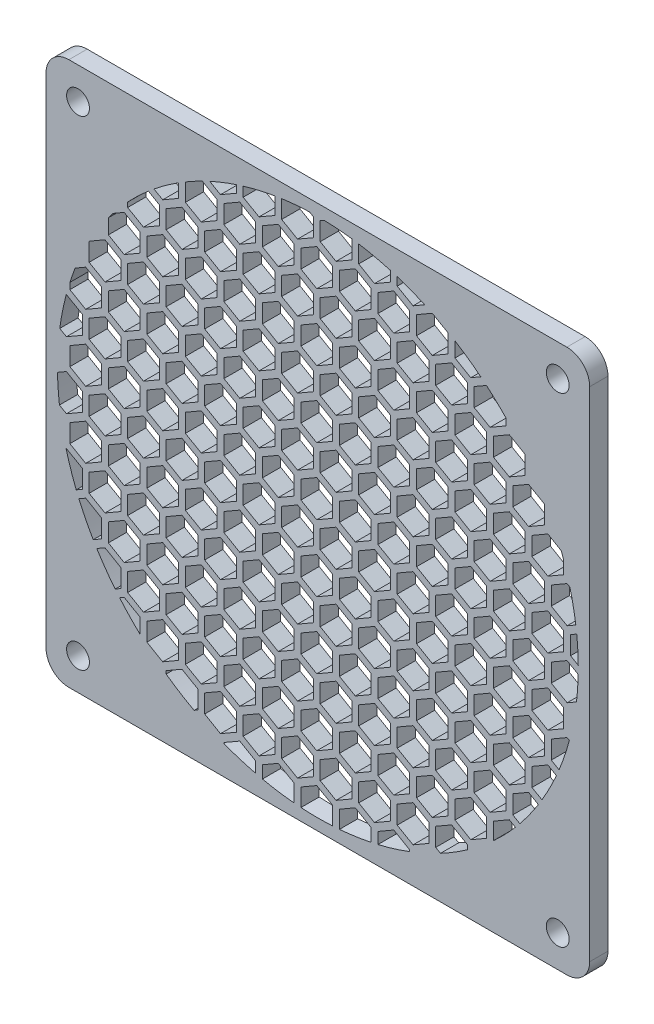
from build123d import *

# Parameters (mm, degrees)
ESQUISSE1_W        = 119
ESQUISSE1_H        = 119
ESQUISSE1_R        = 2.5
BOSS_EXTRU_2_DEPTH = 4
CONG_1_R           = 5


with BuildPart() as part:
    # Esquisse1 → Boss.-Extru.2 (new body)
    with BuildSketch(Plane.XY):
        Rectangle(ESQUISSE1_W, ESQUISSE1_H)
        with Locations((-52.5, -52.5)):
            Circle(ESQUISSE1_R, mode=Mode.SUBTRACT)
        with Locations((52.5, -52.5)):
            Circle(ESQUISSE1_R, mode=Mode.SUBTRACT)
        with Locations((-52.5, 52.5)):
            Circle(ESQUISSE1_R, mode=Mode.SUBTRACT)
        with BuildLine():
            ThreePointArc((-35.866884284, 44.300864684), (-33.23819598, 46.305748326), (-30.497695155, 48.154860505))
            Line((-30.497695155, 48.154860505), (-30.497695155, 45.200961894))
            Line((-30.497695155, 45.200961894), (-33.96179677, 43.200961894))
            Line((-33.96179677, 43.200961894), (-35.866884284, 44.300864684))
        make_face(mode=Mode.SUBTRACT)
        with BuildLine():
            ThreePointArc((-41.64, 38.924419071), (-39.427222396, 41.164233677), (-37.094146812, 43.278450438))
            Line((-37.094146812, 43.278450438), (-34.71179677, 41.903))
            Line((-34.71179677, 41.903), (-34.71179677, 37.903))
            Line((-34.71179677, 37.903), (-38.175898385, 35.903))
            Line((-38.175898385, 35.903), (-41.64, 37.903))
            Line((-41.64, 37.903), (-41.64, 38.924419071))
        make_face(mode=Mode.SUBTRACT)
        with BuildLine():
            ThreePointArc((-45.855898385, 33.856115892), (-45.35289473, 34.527017532), (-44.840076176, 35.19044712))
            Line((-44.840076176, 35.19044712), (-42.39179677, 36.603961894))
            Line((-42.39179677, 36.603961894), (-38.927695155, 34.603961894))
            Line((-38.927695155, 34.603961894), (-38.927695155, 30.603961894))
            Line((-38.927695155, 30.603961894), (-42.39179677, 28.603961894))
            Line((-42.39179677, 28.603961894), (-45.855898385, 30.603961894))
            Line((-45.855898385, 30.603961894), (-45.855898385, 33.856115892))
        make_face(mode=Mode.SUBTRACT)
        with BuildLine():
            ThreePointArc((-50.07, 27.239587001), (-50.043596751, 27.288063769), (-50.017146567, 27.336514944))
            Line((-50.017146567, 27.336514944), (-46.605898385, 29.306))
            Line((-46.605898385, 29.306), (-43.14179677, 27.306))
            Line((-43.14179677, 27.306), (-43.14179677, 23.306))
            Line((-43.14179677, 23.306), (-46.605898385, 21.306))
            Line((-46.605898385, 21.306), (-50.07, 23.306))
            Line((-50.07, 23.306), (-50.07, 27.239587001))
        make_face(mode=Mode.SUBTRACT)
        with BuildLine():
            ThreePointArc((-54.285898385, 17.379333605), (-53.725914344, 19.040118904), (-53.115134759, 20.682902589))
            Line((-53.115134759, 20.682902589), (-50.82179677, 22.006961894))
            Line((-50.82179677, 22.006961894), (-47.357695155, 20.006961894))
            Line((-47.357695155, 20.006961894), (-47.357695155, 16.006961894))
            Line((-47.357695155, 16.006961894), (-50.82179677, 14.006961894))
            Line((-50.82179677, 14.006961894), (-54.285898385, 16.006961894))
            Line((-54.285898385, 16.006961894), (-54.285898385, 17.379333605))
        make_face(mode=Mode.SUBTRACT)
        with BuildLine():
            ThreePointArc((-56.497392033, 7.552793751), (-55.900380768, 11.14214656), (-55.075571993, 14.686094432))
            Line((-55.075571993, 14.686094432), (-55.035898385, 14.709))
            Line((-55.035898385, 14.709), (-51.57179677, 12.709))
            Line((-51.57179677, 12.709), (-51.57179677, 8.709))
            Line((-51.57179677, 8.709), (-55.035898385, 6.709))
            Line((-55.035898385, 6.709), (-56.497392033, 7.552793751))
        make_face(mode=Mode.SUBTRACT)
        with BuildLine():
            ThreePointArc((-56.568125599, -7.003368205), (-56.858374757, -4.015621994), (-56.990931229, -1.016738739))
            Line((-56.990931229, -1.016738739), (-55.035898385, 0.112))
            Line((-55.035898385, 0.112), (-51.57179677, -1.888))
            Line((-51.57179677, -1.888), (-51.57179677, -5.888))
            Line((-51.57179677, -5.888), (-55.035898385, -7.888))
            Line((-55.035898385, -7.888), (-56.568125599, -7.003368205))
        make_face(mode=Mode.SUBTRACT)
        with BuildLine():
            ThreePointArc((-52.891938546, -21.24718421), (-54.108530805, -17.923919609), (-55.116546513, -14.531562218))
            Line((-55.116546513, -14.531562218), (-55.035898385, -14.485))
            Line((-55.035898385, -14.485), (-51.57179677, -16.485))
            Line((-51.57179677, -16.485), (-51.57179677, -20.485))
            Line((-51.57179677, -20.485), (-52.891938546, -21.24718421))
        make_face(mode=Mode.SUBTRACT)
        with BuildLine():
            ThreePointArc((-49.170916986, -28.830902218), (-50.834496577, -25.784762123), (-52.30959477, -22.643018682))
            Line((-52.30959477, -22.643018682), (-50.82179677, -21.784038106))
            Line((-50.82179677, -21.784038106), (-47.357695155, -23.784038106))
            Line((-47.357695155, -23.784038106), (-47.357695155, -27.784038106))
            Line((-47.357695155, -27.784038106), (-49.170916986, -28.830902218))
        make_face(mode=Mode.SUBTRACT)
        with BuildLine():
            ThreePointArc((-44.364618001, -35.787996167), (-46.466520194, -33.013065611), (-48.395109956, -30.115001782))
            Line((-48.395109956, -30.115001782), (-46.605898385, -29.082))
            Line((-46.605898385, -29.082), (-43.14179677, -31.082))
            Line((-43.14179677, -31.082), (-43.14179677, -35.082))
            Line((-43.14179677, -35.082), (-44.364618001, -35.787996167))
        make_face(mode=Mode.SUBTRACT)
        with BuildLine():
            ThreePointArc((-38.927695155, -41.636937327), (-41.22702348, -39.361561643), (-43.393569507, -36.959411865))
            Line((-43.393569507, -36.959411865), (-42.39179677, -36.381038106))
            Line((-42.39179677, -36.381038106), (-38.927695155, -38.381038106))
            Line((-38.927695155, -38.381038106), (-38.927695155, -41.636937327))
        make_face(mode=Mode.SUBTRACT)
        with BuildLine():
            ThreePointArc((-27.094898404, -50.148444447), (-30.212960998, -48.334014811), (-33.21, -46.325974356))
            Line((-33.21, -46.325974356), (-33.21, -45.679))
            Line((-33.21, -45.679), (-29.745898385, -43.679))
            Line((-29.745898385, -43.679), (-26.28179677, -45.679))
            Line((-26.28179677, -45.679), (-26.28179677, -49.679))
            Line((-26.28179677, -49.679), (-27.094898404, -50.148444447))
        make_face(mode=Mode.SUBTRACT)
        with BuildLine():
            ThreePointArc((-13.637695155, -55.344496302), (-17.136623375, -54.363003406), (-20.565898385, -53.160547623))
            Line((-20.565898385, -53.160547623), (-20.565898385, -52.978038106))
            Line((-20.565898385, -52.978038106), (-17.10179677, -50.978038106))
            Line((-17.10179677, -50.978038106), (-13.637695155, -52.978038106))
            Line((-13.637695155, -52.978038106), (-13.637695155, -55.344496302))
        make_face(mode=Mode.SUBTRACT)
        with BuildLine():
            ThreePointArc((-5.207695155, -56.76160596), (-8.688238732, -56.333955193), (-12.135898385, -55.693087277))
            Line((-12.135898385, -55.693087277), (-12.135898385, -52.978038106))
            Line((-12.135898385, -52.978038106), (-8.67179677, -50.978038106))
            Line((-8.67179677, -50.978038106), (-5.207695155, -52.978038106))
            Line((-5.207695155, -52.978038106), (-5.207695155, -56.76160596))
        make_face(mode=Mode.SUBTRACT)
        with BuildLine():
            ThreePointArc((3.222304845, -56.908845986), (-0.24224455, -56.99948524), (-3.705898385, -56.879401519))
            Line((-3.705898385, -56.879401519), (-3.705898385, -52.978038106))
            Line((-3.705898385, -52.978038106), (-0.24179677, -50.978038106))
            Line((-0.24179677, -50.978038106), (3.222304845, -52.978038106))
            Line((3.222304845, -52.978038106), (3.222304845, -56.908845986))
        make_face(mode=Mode.SUBTRACT)
        with BuildLine():
            ThreePointArc((11.652304845, -55.796270411), (8.203688234, -56.406555464), (4.724101615, -56.803898316))
            Line((4.724101615, -56.803898316), (4.724101615, -52.978038106))
            Line((4.724101615, -52.978038106), (8.18820323, -50.978038106))
            Line((8.18820323, -50.978038106), (11.652304845, -52.978038106))
            Line((11.652304845, -52.978038106), (11.652304845, -55.796270411))
        make_face(mode=Mode.SUBTRACT)
        with BuildLine():
            ThreePointArc((20.082304845, -53.345112542), (16.651857936, -54.513444464), (13.154101615, -55.461424528))
            Line((13.154101615, -55.461424528), (13.154101615, -52.978038106))
            Line((13.154101615, -52.978038106), (16.61820323, -50.978038106))
            Line((16.61820323, -50.978038106), (20.082304845, -52.978038106))
            Line((20.082304845, -52.978038106), (20.082304845, -53.345112542))
        make_face(mode=Mode.SUBTRACT)
        with BuildLine():
            ThreePointArc((32.72820323, -46.66759811), (29.841537458, -48.564211537), (26.845296739, -50.282502354))
            Line((26.845296739, -50.282502354), (25.8, -49.679))
            Line((25.8, -49.679), (25.8, -45.679))
            Line((25.8, -45.679), (29.264101615, -43.679))
            Line((29.264101615, -43.679), (32.72820323, -45.679))
            Line((32.72820323, -45.679), (32.72820323, -46.66759811))
        make_face(mode=Mode.SUBTRACT)
        with BuildLine():
            ThreePointArc((43.233688705, -37.146307501), (40.913447759, -39.687400928), (38.444101615, -42.083857368))
            Line((38.444101615, -42.083857368), (38.444101615, -38.381038106))
            Line((38.444101615, -38.381038106), (41.90820323, -36.381038106))
            Line((41.90820323, -36.381038106), (43.233688705, -37.146307501))
        make_face(mode=Mode.SUBTRACT)
        with BuildLine():
            ThreePointArc((48.267324172, -30.31939012), (46.325661729, -33.210436092), (44.211070112, -35.977510747))
            Line((44.211070112, -35.977510747), (42.66, -35.082))
            Line((42.66, -35.082), (42.66, -31.082))
            Line((42.66, -31.082), (46.124101615, -29.082))
            Line((46.124101615, -29.082), (48.267324172, -30.31939012))
        make_face(mode=Mode.SUBTRACT)
        with BuildLine():
            ThreePointArc((52.21244951, -22.8661347), (50.724303411, -26.000866205), (49.048167948, -29.039235888))
            Line((49.048167948, -29.039235888), (46.874101615, -27.784038106))
            Line((46.874101615, -27.784038106), (46.874101615, -23.784038106))
            Line((46.874101615, -23.784038106), (50.33820323, -21.784038106))
            Line((50.33820323, -21.784038106), (52.21244951, -22.8661347))
        make_face(mode=Mode.SUBTRACT)
        with BuildLine():
            ThreePointArc((55.052406326, -14.772696359), (54.030546997, -18.157642776), (52.800779674, -21.472719105))
            Line((52.800779674, -21.472719105), (51.09, -20.485))
            Line((51.09, -20.485), (51.09, -16.485))
            Line((51.09, -16.485), (54.554101615, -14.485))
            Line((54.554101615, -14.485), (55.052406326, -14.772696359))
        make_face(mode=Mode.SUBTRACT)
        with BuildLine():
            ThreePointArc((56.9853625, -1.291689126), (56.859298223, -4.002524896), (56.604350723, -6.704288126))
            Line((56.604350723, -6.704288126), (54.554101615, -7.888))
            Line((54.554101615, -7.888), (51.09, -5.888))
            Line((51.09, -5.888), (51.09, -1.888))
            Line((51.09, -1.888), (54.554101615, 0.112))
            Line((54.554101615, 0.112), (56.9853625, -1.291689126))
        make_face(mode=Mode.SUBTRACT)
        with BuildLine():
            ThreePointArc((56.662438281, 6.194197934), (56.903390908, 3.317243317), (56.998364601, 0.431778704))
            Line((56.998364601, 0.431778704), (55.304101615, 1.409961894))
            Line((55.304101615, 1.409961894), (55.304101615, 5.409961894))
            Line((55.304101615, 5.409961894), (56.662438281, 6.194197934))
        make_face(mode=Mode.SUBTRACT)
        with BuildLine():
            ThreePointArc((55.162007883, 14.358025152), (55.908086473, 11.103416905), (56.462313631, 7.810706721))
            Line((56.462313631, 7.810706721), (54.554101615, 6.709))
            Line((54.554101615, 6.709), (51.09, 8.709))
            Line((51.09, 8.709), (51.09, 12.709))
            Line((51.09, 12.709), (54.554101615, 14.709))
            Line((54.554101615, 14.709), (55.162007883, 14.358025152))
        make_face(mode=Mode.SUBTRACT)
        with BuildLine():
            ThreePointArc((53.253587924, 20.323763757), (53.533204502, 19.575393118), (53.802304845, 18.823177025))
            Line((53.802304845, 18.823177025), (53.802304845, 16.006961894))
            Line((53.802304845, 16.006961894), (50.33820323, 14.006961894))
            Line((50.33820323, 14.006961894), (46.874101615, 16.006961894))
            Line((46.874101615, 16.006961894), (46.874101615, 20.006961894))
            Line((46.874101615, 20.006961894), (50.33820323, 22.006961894))
            Line((50.33820323, 22.006961894), (53.253587924, 20.323763757))
        make_face(mode=Mode.SUBTRACT)
        with BuildLine():
            ThreePointArc((45.232381736, 34.684746539), (45.302435937, 34.593197281), (45.372304845, 34.501506533))
            Line((45.372304845, 34.501506533), (45.372304845, 30.603961894))
            Line((45.372304845, 30.603961894), (41.90820323, 28.603961894))
            Line((41.90820323, 28.603961894), (38.444101615, 30.603961894))
            Line((38.444101615, 30.603961894), (38.444101615, 34.603961894))
            Line((38.444101615, 34.603961894), (41.90820323, 36.603961894))
            Line((41.90820323, 36.603961894), (45.232381736, 34.684746539))
        make_face(mode=Mode.SUBTRACT)
        with BuildLine():
            ThreePointArc((36.899703372, 43.444353961), (39.080441374, 41.493603146), (41.15820323, 39.433517556))
            Line((41.15820323, 39.433517556), (41.15820323, 37.903))
            Line((41.15820323, 37.903), (37.694101615, 35.903))
            Line((37.694101615, 35.903), (34.23, 37.903))
            Line((34.23, 37.903), (34.23, 41.903))
            Line((34.23, 41.903), (36.899703372, 43.444353961))
        make_face(mode=Mode.SUBTRACT)
        with BuildLine():
            ThreePointArc((30.014101615, 48.457751746), (32.900237782, 46.546475204), (35.665033335, 44.463528844))
            Line((35.665033335, 44.463528844), (33.47820323, 43.200961894))
            Line((33.47820323, 43.200961894), (30.014101615, 45.200961894))
            Line((30.014101615, 45.200961894), (30.014101615, 48.457751746))
        make_face(mode=Mode.SUBTRACT)
        with BuildLine():
            ThreePointArc((17.37, 54.288885603), (20.414782743, 53.218762157), (23.394118381, 51.978026369))
            Line((23.394118381, 51.978026369), (20.834101615, 50.5))
            Line((20.834101615, 50.5), (17.37, 52.5))
            Line((17.37, 52.5), (17.37, 54.288885603))
        make_face(mode=Mode.SUBTRACT)
        with BuildLine():
            ThreePointArc((8.94, 56.294550358), (12.428222092, 55.628583441), (15.86820323, 54.746690551))
            Line((15.86820323, 54.746690551), (15.86820323, 52.5))
            Line((15.86820323, 52.5), (12.404101615, 50.5))
            Line((12.404101615, 50.5), (8.94, 52.5))
            Line((8.94, 52.5), (8.94, 56.294550358))
        make_face(mode=Mode.SUBTRACT)
        with BuildLine():
            ThreePointArc((1.348397226, 56.984048864), (4.385423005, 56.831048425), (7.409967491, 56.516301912))
            Line((7.409967491, 56.516301912), (7.43820323, 56.5))
            Line((7.43820323, 56.5), (7.43820323, 52.5))
            Line((7.43820323, 52.5), (3.974101615, 50.5))
            Line((3.974101615, 50.5), (0.51, 52.5))
            Line((0.51, 52.5), (0.51, 56.5))
            Line((0.51, 56.5), (1.348397226, 56.984048864))
        make_face(mode=Mode.SUBTRACT)
        with BuildLine():
            ThreePointArc((-7.92, 56.447086727), (-4.871125691, 56.791479418), (-1.808136899, 56.971314194))
            Line((-1.808136899, 56.971314194), (-0.99179677, 56.5))
            Line((-0.99179677, 56.5), (-0.99179677, 52.5))
            Line((-0.99179677, 52.5), (-4.455898385, 50.5))
            Line((-4.455898385, 50.5), (-7.92, 52.5))
            Line((-7.92, 52.5), (-7.92, 56.447086727))
        make_face(mode=Mode.SUBTRACT)
        with BuildLine():
            ThreePointArc((-16.35, 54.604738805), (-12.911055495, 55.518507239), (-9.42179677, 56.215920749))
            Line((-9.42179677, 56.215920749), (-9.42179677, 52.5))
            Line((-9.42179677, 52.5), (-12.885898385, 50.5))
            Line((-12.885898385, 50.5), (-16.35, 52.5))
            Line((-16.35, 52.5), (-16.35, 54.604738805))
        make_face(mode=Mode.SUBTRACT)
        with BuildLine():
            ThreePointArc((-23.664035973, 51.855697869), (-20.789105313, 53.07365731), (-17.85179677, 54.132368802))
            Line((-17.85179677, 54.132368802), (-17.85179677, 52.5))
            Line((-17.85179677, 52.5), (-21.315898385, 50.5))
            Line((-21.315898385, 50.5), (-23.664035973, 51.855697869))
        make_face(mode=Mode.SUBTRACT)
        with BuildLine():
            ThreePointArc((-28.995898385, 49.07380031), (-27.171163905, 50.10716368), (-25.30965347, 51.072707401))
            Line((-25.30965347, 51.072707401), (-22.067695155, 49.200961894))
            Line((-22.067695155, 49.200961894), (-22.067695155, 45.200961894))
            Line((-22.067695155, 45.200961894), (-25.53179677, 43.200961894))
            Line((-25.53179677, 43.200961894), (-28.995898385, 45.200961894))
            Line((-28.995898385, 45.200961894), (-28.995898385, 49.07380031))
        make_face(mode=Mode.SUBTRACT)
        with Locations((52.5, 52.5)):
            Circle(ESQUISSE1_R, mode=Mode.SUBTRACT)
        Polygon((28.512304845, 34.603961894), (28.512304845, 30.603961894), (25.04820323, 28.603961894), (21.584101615, 30.603961894), (21.584101615, 34.603961894), (25.04820323, 36.603961894), align=None, mode=Mode.SUBTRACT)
        Polygon((17.37, 37.903), (17.37, 41.903), (20.834101615, 43.903), (24.29820323, 41.903), (24.29820323, 37.903), (20.834101615, 35.903), align=None, mode=Mode.SUBTRACT)
        Polygon((25.8, 37.903), (25.8, 41.903), (29.264101615, 43.903), (32.72820323, 41.903), (32.72820323, 37.903), (29.264101615, 35.903), align=None, mode=Mode.SUBTRACT)
        Polygon((4.724101615, 49.200961894), (8.18820323, 51.200961894), (11.652304845, 49.200961894), (11.652304845, 45.200961894), (8.18820323, 43.200961894), (4.724101615, 45.200961894), align=None, mode=Mode.SUBTRACT)
        Polygon((13.154101615, 49.200961894), (16.61820323, 51.200961894), (20.082304845, 49.200961894), (20.082304845, 45.200961894), (16.61820323, 43.200961894), (13.154101615, 45.200961894), align=None, mode=Mode.SUBTRACT)
        Polygon((21.584101615, 49.200961894), (25.04820323, 51.200961894), (28.512304845, 49.200961894), (28.512304845, 45.200961894), (25.04820323, 43.200961894), (21.584101615, 45.200961894), align=None, mode=Mode.SUBTRACT)
        Polygon((30.014101615, 34.603961894), (33.47820323, 36.603961894), (36.942304845, 34.603961894), (36.942304845, 30.603961894), (33.47820323, 28.603961894), (30.014101615, 30.603961894), align=None, mode=Mode.SUBTRACT)
        Polygon((-37.425898385, -38.381038106), (-33.96179677, -36.381038106), (-30.497695155, -38.381038106), (-30.497695155, -42.381038106), (-33.96179677, -44.381038106), (-37.425898385, -42.381038106), align=None, mode=Mode.SUBTRACT)
        Polygon((-41.64, -35.082), (-41.64, -31.082), (-38.175898385, -29.082), (-34.71179677, -31.082), (-34.71179677, -35.082), (-38.175898385, -37.082), align=None, mode=Mode.SUBTRACT)
        Polygon((-24.78, -49.679), (-24.78, -45.679), (-21.315898385, -43.679), (-17.85179677, -45.679), (-17.85179677, -49.679), (-21.315898385, -51.679), align=None, mode=Mode.SUBTRACT)
        Polygon((-16.35, -49.679), (-16.35, -45.679), (-12.885898385, -43.679), (-9.42179677, -45.679), (-9.42179677, -49.679), (-12.885898385, -51.679), align=None, mode=Mode.SUBTRACT)
        Polygon((-7.92, -49.679), (-7.92, -45.679), (-4.455898385, -43.679), (-0.99179677, -45.679), (-0.99179677, -49.679), (-4.455898385, -51.679), align=None, mode=Mode.SUBTRACT)
        Polygon((-28.995898385, -38.381038106), (-25.53179677, -36.381038106), (-22.067695155, -38.381038106), (-22.067695155, -42.381038106), (-25.53179677, -44.381038106), (-28.995898385, -42.381038106), align=None, mode=Mode.SUBTRACT)
        Polygon((-20.565898385, -38.381038106), (-17.10179677, -36.381038106), (-13.637695155, -38.381038106), (-13.637695155, -42.381038106), (-17.10179677, -44.381038106), (-20.565898385, -42.381038106), align=None, mode=Mode.SUBTRACT)
        Polygon((-33.21, -35.082), (-33.21, -31.082), (-29.745898385, -29.082), (-26.28179677, -31.082), (-26.28179677, -35.082), (-29.745898385, -37.082), align=None, mode=Mode.SUBTRACT)
        Polygon((-24.78, -35.082), (-24.78, -31.082), (-21.315898385, -29.082), (-17.85179677, -31.082), (-17.85179677, -35.082), (-21.315898385, -37.082), align=None, mode=Mode.SUBTRACT)
        Polygon((-12.135898385, -38.381038106), (-8.67179677, -36.381038106), (-5.207695155, -38.381038106), (-5.207695155, -42.381038106), (-8.67179677, -44.381038106), (-12.135898385, -42.381038106), align=None, mode=Mode.SUBTRACT)
        Polygon((-3.705898385, -38.381038106), (-0.24179677, -36.381038106), (3.222304845, -38.381038106), (3.222304845, -42.381038106), (-0.24179677, -44.381038106), (-3.705898385, -42.381038106), align=None, mode=Mode.SUBTRACT)
        Polygon((-16.35, -35.082), (-16.35, -31.082), (-12.885898385, -29.082), (-9.42179677, -31.082), (-9.42179677, -35.082), (-12.885898385, -37.082), align=None, mode=Mode.SUBTRACT)
        Polygon((-7.92, -35.082), (-7.92, -31.082), (-4.455898385, -29.082), (-0.99179677, -31.082), (-0.99179677, -35.082), (-4.455898385, -37.082), align=None, mode=Mode.SUBTRACT)
        Polygon((-50.07, -20.485), (-50.07, -16.485), (-46.605898385, -14.485), (-43.14179677, -16.485), (-43.14179677, -20.485), (-46.605898385, -22.485), align=None, mode=Mode.SUBTRACT)
        Polygon((-45.855898385, -23.784038106), (-42.39179677, -21.784038106), (-38.927695155, -23.784038106), (-38.927695155, -27.784038106), (-42.39179677, -29.784038106), (-45.855898385, -27.784038106), align=None, mode=Mode.SUBTRACT)
        Polygon((-37.425898385, -23.784038106), (-33.96179677, -21.784038106), (-30.497695155, -23.784038106), (-30.497695155, -27.784038106), (-33.96179677, -29.784038106), (-37.425898385, -27.784038106), align=None, mode=Mode.SUBTRACT)
        Polygon((-41.64, -20.485), (-41.64, -16.485), (-38.175898385, -14.485), (-34.71179677, -16.485), (-34.71179677, -20.485), (-38.175898385, -22.485), align=None, mode=Mode.SUBTRACT)
        Polygon((-54.285898385, -9.187038106), (-50.82179677, -7.187038106), (-47.357695155, -9.187038106), (-47.357695155, -13.187038106), (-50.82179677, -15.187038106), (-54.285898385, -13.187038106), align=None, mode=Mode.SUBTRACT)
        Polygon((-50.07, -5.888), (-50.07, -1.888), (-46.605898385, 0.112), (-43.14179677, -1.888), (-43.14179677, -5.888), (-46.605898385, -7.888), align=None, mode=Mode.SUBTRACT)
        Polygon((-45.855898385, -9.187038106), (-42.39179677, -7.187038106), (-38.927695155, -9.187038106), (-38.927695155, -13.187038106), (-42.39179677, -15.187038106), (-45.855898385, -13.187038106), align=None, mode=Mode.SUBTRACT)
        Polygon((-37.425898385, -9.187038106), (-33.96179677, -7.187038106), (-30.497695155, -9.187038106), (-30.497695155, -13.187038106), (-33.96179677, -15.187038106), (-37.425898385, -13.187038106), align=None, mode=Mode.SUBTRACT)
        Polygon((-41.64, -5.888), (-41.64, -1.888), (-38.175898385, 0.112), (-34.71179677, -1.888), (-34.71179677, -5.888), (-38.175898385, -7.888), align=None, mode=Mode.SUBTRACT)
        Polygon((-28.995898385, -23.784038106), (-25.53179677, -21.784038106), (-22.067695155, -23.784038106), (-22.067695155, -27.784038106), (-25.53179677, -29.784038106), (-28.995898385, -27.784038106), align=None, mode=Mode.SUBTRACT)
        Polygon((-20.565898385, -23.784038106), (-17.10179677, -21.784038106), (-13.637695155, -23.784038106), (-13.637695155, -27.784038106), (-17.10179677, -29.784038106), (-20.565898385, -27.784038106), align=None, mode=Mode.SUBTRACT)
        Polygon((-33.21, -20.485), (-33.21, -16.485), (-29.745898385, -14.485), (-26.28179677, -16.485), (-26.28179677, -20.485), (-29.745898385, -22.485), align=None, mode=Mode.SUBTRACT)
        Polygon((-24.78, -20.485), (-24.78, -16.485), (-21.315898385, -14.485), (-17.85179677, -16.485), (-17.85179677, -20.485), (-21.315898385, -22.485), align=None, mode=Mode.SUBTRACT)
        Polygon((-12.135898385, -23.784038106), (-8.67179677, -21.784038106), (-5.207695155, -23.784038106), (-5.207695155, -27.784038106), (-8.67179677, -29.784038106), (-12.135898385, -27.784038106), align=None, mode=Mode.SUBTRACT)
        Polygon((-3.705898385, -23.784038106), (-0.24179677, -21.784038106), (3.222304845, -23.784038106), (3.222304845, -27.784038106), (-0.24179677, -29.784038106), (-3.705898385, -27.784038106), align=None, mode=Mode.SUBTRACT)
        Polygon((-16.35, -20.485), (-16.35, -16.485), (-12.885898385, -14.485), (-9.42179677, -16.485), (-9.42179677, -20.485), (-12.885898385, -22.485), align=None, mode=Mode.SUBTRACT)
        Polygon((-7.92, -20.485), (-7.92, -16.485), (-4.455898385, -14.485), (-0.99179677, -16.485), (-0.99179677, -20.485), (-4.455898385, -22.485), align=None, mode=Mode.SUBTRACT)
        Polygon((-28.995898385, -9.187038106), (-25.53179677, -7.187038106), (-22.067695155, -9.187038106), (-22.067695155, -13.187038106), (-25.53179677, -15.187038106), (-28.995898385, -13.187038106), align=None, mode=Mode.SUBTRACT)
        Polygon((-20.565898385, -9.187038106), (-17.10179677, -7.187038106), (-13.637695155, -9.187038106), (-13.637695155, -13.187038106), (-17.10179677, -15.187038106), (-20.565898385, -13.187038106), align=None, mode=Mode.SUBTRACT)
        Polygon((-33.21, -5.888), (-33.21, -1.888), (-29.745898385, 0.112), (-26.28179677, -1.888), (-26.28179677, -5.888), (-29.745898385, -7.888), align=None, mode=Mode.SUBTRACT)
        Polygon((-24.78, -5.888), (-24.78, -1.888), (-21.315898385, 0.112), (-17.85179677, -1.888), (-17.85179677, -5.888), (-21.315898385, -7.888), align=None, mode=Mode.SUBTRACT)
        Polygon((-12.135898385, -9.187038106), (-8.67179677, -7.187038106), (-5.207695155, -9.187038106), (-5.207695155, -13.187038106), (-8.67179677, -15.187038106), (-12.135898385, -13.187038106), align=None, mode=Mode.SUBTRACT)
        Polygon((-3.705898385, -9.187038106), (-0.24179677, -7.187038106), (3.222304845, -9.187038106), (3.222304845, -13.187038106), (-0.24179677, -15.187038106), (-3.705898385, -13.187038106), align=None, mode=Mode.SUBTRACT)
        Polygon((-16.35, -5.888), (-16.35, -1.888), (-12.885898385, 0.112), (-9.42179677, -1.888), (-9.42179677, -5.888), (-12.885898385, -7.888), align=None, mode=Mode.SUBTRACT)
        Polygon((-7.92, -5.888), (-7.92, -1.888), (-4.455898385, 0.112), (-0.99179677, -1.888), (-0.99179677, -5.888), (-4.455898385, -7.888), align=None, mode=Mode.SUBTRACT)
        Polygon((0.51, -49.679), (0.51, -45.679), (3.974101615, -43.679), (7.43820323, -45.679), (7.43820323, -49.679), (3.974101615, -51.679), align=None, mode=Mode.SUBTRACT)
        Polygon((8.94, -49.679), (8.94, -45.679), (12.404101615, -43.679), (15.86820323, -45.679), (15.86820323, -49.679), (12.404101615, -51.679), align=None, mode=Mode.SUBTRACT)
        Polygon((17.37, -49.679), (17.37, -45.679), (20.834101615, -43.679), (24.29820323, -45.679), (24.29820323, -49.679), (20.834101615, -51.679), align=None, mode=Mode.SUBTRACT)
        Polygon((4.724101615, -38.381038106), (8.18820323, -36.381038106), (11.652304845, -38.381038106), (11.652304845, -42.381038106), (8.18820323, -44.381038106), (4.724101615, -42.381038106), align=None, mode=Mode.SUBTRACT)
        Polygon((0.51, -35.082), (0.51, -31.082), (3.974101615, -29.082), (7.43820323, -31.082), (7.43820323, -35.082), (3.974101615, -37.082), align=None, mode=Mode.SUBTRACT)
        Polygon((8.94, -35.082), (8.94, -31.082), (12.404101615, -29.082), (15.86820323, -31.082), (15.86820323, -35.082), (12.404101615, -37.082), align=None, mode=Mode.SUBTRACT)
        Polygon((13.154101615, -38.381038106), (16.61820323, -36.381038106), (20.082304845, -38.381038106), (20.082304845, -42.381038106), (16.61820323, -44.381038106), (13.154101615, -42.381038106), align=None, mode=Mode.SUBTRACT)
        Polygon((21.584101615, -38.381038106), (25.04820323, -36.381038106), (28.512304845, -38.381038106), (28.512304845, -42.381038106), (25.04820323, -44.381038106), (21.584101615, -42.381038106), align=None, mode=Mode.SUBTRACT)
        Polygon((17.37, -35.082), (17.37, -31.082), (20.834101615, -29.082), (24.29820323, -31.082), (24.29820323, -35.082), (20.834101615, -37.082), align=None, mode=Mode.SUBTRACT)
        Polygon((25.8, -35.082), (25.8, -31.082), (29.264101615, -29.082), (32.72820323, -31.082), (32.72820323, -35.082), (29.264101615, -37.082), align=None, mode=Mode.SUBTRACT)
        Polygon((30.014101615, -38.381038106), (33.47820323, -36.381038106), (36.942304845, -38.381038106), (36.942304845, -42.381038106), (33.47820323, -44.381038106), (30.014101615, -42.381038106), align=None, mode=Mode.SUBTRACT)
        Polygon((34.23, -35.082), (34.23, -31.082), (37.694101615, -29.082), (41.15820323, -31.082), (41.15820323, -35.082), (37.694101615, -37.082), align=None, mode=Mode.SUBTRACT)
        Polygon((4.724101615, -23.784038106), (8.18820323, -21.784038106), (11.652304845, -23.784038106), (11.652304845, -27.784038106), (8.18820323, -29.784038106), (4.724101615, -27.784038106), align=None, mode=Mode.SUBTRACT)
        Polygon((0.51, -20.485), (0.51, -16.485), (3.974101615, -14.485), (7.43820323, -16.485), (7.43820323, -20.485), (3.974101615, -22.485), align=None, mode=Mode.SUBTRACT)
        Polygon((8.94, -20.485), (8.94, -16.485), (12.404101615, -14.485), (15.86820323, -16.485), (15.86820323, -20.485), (12.404101615, -22.485), align=None, mode=Mode.SUBTRACT)
        Polygon((13.154101615, -23.784038106), (16.61820323, -21.784038106), (20.082304845, -23.784038106), (20.082304845, -27.784038106), (16.61820323, -29.784038106), (13.154101615, -27.784038106), align=None, mode=Mode.SUBTRACT)
        Polygon((21.584101615, -23.784038106), (25.04820323, -21.784038106), (28.512304845, -23.784038106), (28.512304845, -27.784038106), (25.04820323, -29.784038106), (21.584101615, -27.784038106), align=None, mode=Mode.SUBTRACT)
        Polygon((17.37, -20.485), (17.37, -16.485), (20.834101615, -14.485), (24.29820323, -16.485), (24.29820323, -20.485), (20.834101615, -22.485), align=None, mode=Mode.SUBTRACT)
        Polygon((25.8, -20.485), (25.8, -16.485), (29.264101615, -14.485), (32.72820323, -16.485), (32.72820323, -20.485), (29.264101615, -22.485), align=None, mode=Mode.SUBTRACT)
        Polygon((4.724101615, -9.187038106), (8.18820323, -7.187038106), (11.652304845, -9.187038106), (11.652304845, -13.187038106), (8.18820323, -15.187038106), (4.724101615, -13.187038106), align=None, mode=Mode.SUBTRACT)
        Polygon((0.51, -5.888), (0.51, -1.888), (3.974101615, 0.112), (7.43820323, -1.888), (7.43820323, -5.888), (3.974101615, -7.888), align=None, mode=Mode.SUBTRACT)
        Polygon((8.94, -5.888), (8.94, -1.888), (12.404101615, 0.112), (15.86820323, -1.888), (15.86820323, -5.888), (12.404101615, -7.888), align=None, mode=Mode.SUBTRACT)
        Polygon((13.154101615, -9.187038106), (16.61820323, -7.187038106), (20.082304845, -9.187038106), (20.082304845, -13.187038106), (16.61820323, -15.187038106), (13.154101615, -13.187038106), align=None, mode=Mode.SUBTRACT)
        Polygon((21.584101615, -9.187038106), (25.04820323, -7.187038106), (28.512304845, -9.187038106), (28.512304845, -13.187038106), (25.04820323, -15.187038106), (21.584101615, -13.187038106), align=None, mode=Mode.SUBTRACT)
        Polygon((17.37, -5.888), (17.37, -1.888), (20.834101615, 0.112), (24.29820323, -1.888), (24.29820323, -5.888), (20.834101615, -7.888), align=None, mode=Mode.SUBTRACT)
        Polygon((25.8, -5.888), (25.8, -1.888), (29.264101615, 0.112), (32.72820323, -1.888), (32.72820323, -5.888), (29.264101615, -7.888), align=None, mode=Mode.SUBTRACT)
        Polygon((30.014101615, -23.784038106), (33.47820323, -21.784038106), (36.942304845, -23.784038106), (36.942304845, -27.784038106), (33.47820323, -29.784038106), (30.014101615, -27.784038106), align=None, mode=Mode.SUBTRACT)
        Polygon((38.444101615, -23.784038106), (41.90820323, -21.784038106), (45.372304845, -23.784038106), (45.372304845, -27.784038106), (41.90820323, -29.784038106), (38.444101615, -27.784038106), align=None, mode=Mode.SUBTRACT)
        Polygon((34.23, -20.485), (34.23, -16.485), (37.694101615, -14.485), (41.15820323, -16.485), (41.15820323, -20.485), (37.694101615, -22.485), align=None, mode=Mode.SUBTRACT)
        Polygon((42.66, -20.485), (42.66, -16.485), (46.124101615, -14.485), (49.58820323, -16.485), (49.58820323, -20.485), (46.124101615, -22.485), align=None, mode=Mode.SUBTRACT)
        Polygon((30.014101615, -9.187038106), (33.47820323, -7.187038106), (36.942304845, -9.187038106), (36.942304845, -13.187038106), (33.47820323, -15.187038106), (30.014101615, -13.187038106), align=None, mode=Mode.SUBTRACT)
        Polygon((38.444101615, -9.187038106), (41.90820323, -7.187038106), (45.372304845, -9.187038106), (45.372304845, -13.187038106), (41.90820323, -15.187038106), (38.444101615, -13.187038106), align=None, mode=Mode.SUBTRACT)
        Polygon((34.23, -5.888), (34.23, -1.888), (37.694101615, 0.112), (41.15820323, -1.888), (41.15820323, -5.888), (37.694101615, -7.888), align=None, mode=Mode.SUBTRACT)
        Polygon((46.874101615, -9.187038106), (50.33820323, -7.187038106), (53.802304845, -9.187038106), (53.802304845, -13.187038106), (50.33820323, -15.187038106), (46.874101615, -13.187038106), align=None, mode=Mode.SUBTRACT)
        Polygon((42.66, -5.888), (42.66, -1.888), (46.124101615, 0.112), (49.58820323, -1.888), (49.58820323, -5.888), (46.124101615, -7.888), align=None, mode=Mode.SUBTRACT)
        Polygon((-54.285898385, 5.409961894), (-50.82179677, 7.409961894), (-47.357695155, 5.409961894), (-47.357695155, 1.409961894), (-50.82179677, -0.590038106), (-54.285898385, 1.409961894), align=None, mode=Mode.SUBTRACT)
        Polygon((-50.07, 8.709), (-50.07, 12.709), (-46.605898385, 14.709), (-43.14179677, 12.709), (-43.14179677, 8.709), (-46.605898385, 6.709), align=None, mode=Mode.SUBTRACT)
        Polygon((-45.855898385, 5.409961894), (-42.39179677, 7.409961894), (-38.927695155, 5.409961894), (-38.927695155, 1.409961894), (-42.39179677, -0.590038106), (-45.855898385, 1.409961894), align=None, mode=Mode.SUBTRACT)
        Polygon((-37.425898385, 5.409961894), (-33.96179677, 7.409961894), (-30.497695155, 5.409961894), (-30.497695155, 1.409961894), (-33.96179677, -0.590038106), (-37.425898385, 1.409961894), align=None, mode=Mode.SUBTRACT)
        Polygon((-41.64, 8.709), (-41.64, 12.709), (-38.175898385, 14.709), (-34.71179677, 12.709), (-34.71179677, 8.709), (-38.175898385, 6.709), align=None, mode=Mode.SUBTRACT)
        Polygon((-45.855898385, 20.006961894), (-42.39179677, 22.006961894), (-38.927695155, 20.006961894), (-38.927695155, 16.006961894), (-42.39179677, 14.006961894), (-45.855898385, 16.006961894), align=None, mode=Mode.SUBTRACT)
        Polygon((-37.425898385, 20.006961894), (-33.96179677, 22.006961894), (-30.497695155, 20.006961894), (-30.497695155, 16.006961894), (-33.96179677, 14.006961894), (-37.425898385, 16.006961894), align=None, mode=Mode.SUBTRACT)
        Polygon((-41.64, 23.306), (-41.64, 27.306), (-38.175898385, 29.306), (-34.71179677, 27.306), (-34.71179677, 23.306), (-38.175898385, 21.306), align=None, mode=Mode.SUBTRACT)
        Polygon((-28.995898385, 5.409961894), (-25.53179677, 7.409961894), (-22.067695155, 5.409961894), (-22.067695155, 1.409961894), (-25.53179677, -0.590038106), (-28.995898385, 1.409961894), align=None, mode=Mode.SUBTRACT)
        Polygon((-20.565898385, 5.409961894), (-17.10179677, 7.409961894), (-13.637695155, 5.409961894), (-13.637695155, 1.409961894), (-17.10179677, -0.590038106), (-20.565898385, 1.409961894), align=None, mode=Mode.SUBTRACT)
        Polygon((-33.21, 8.709), (-33.21, 12.709), (-29.745898385, 14.709), (-26.28179677, 12.709), (-26.28179677, 8.709), (-29.745898385, 6.709), align=None, mode=Mode.SUBTRACT)
        Polygon((-24.78, 8.709), (-24.78, 12.709), (-21.315898385, 14.709), (-17.85179677, 12.709), (-17.85179677, 8.709), (-21.315898385, 6.709), align=None, mode=Mode.SUBTRACT)
        Polygon((-12.135898385, 5.409961894), (-8.67179677, 7.409961894), (-5.207695155, 5.409961894), (-5.207695155, 1.409961894), (-8.67179677, -0.590038106), (-12.135898385, 1.409961894), align=None, mode=Mode.SUBTRACT)
        Polygon((-3.705898385, 5.409961894), (-0.24179677, 7.409961894), (3.222304845, 5.409961894), (3.222304845, 1.409961894), (-0.24179677, -0.590038106), (-3.705898385, 1.409961894), align=None, mode=Mode.SUBTRACT)
        Polygon((-16.35, 8.709), (-16.35, 12.709), (-12.885898385, 14.709), (-9.42179677, 12.709), (-9.42179677, 8.709), (-12.885898385, 6.709), align=None, mode=Mode.SUBTRACT)
        Polygon((-7.92, 8.709), (-7.92, 12.709), (-4.455898385, 14.709), (-0.99179677, 12.709), (-0.99179677, 8.709), (-4.455898385, 6.709), align=None, mode=Mode.SUBTRACT)
        Polygon((-28.995898385, 20.006961894), (-25.53179677, 22.006961894), (-22.067695155, 20.006961894), (-22.067695155, 16.006961894), (-25.53179677, 14.006961894), (-28.995898385, 16.006961894), align=None, mode=Mode.SUBTRACT)
        Polygon((-20.565898385, 20.006961894), (-17.10179677, 22.006961894), (-13.637695155, 20.006961894), (-13.637695155, 16.006961894), (-17.10179677, 14.006961894), (-20.565898385, 16.006961894), align=None, mode=Mode.SUBTRACT)
        Polygon((-33.21, 23.306), (-33.21, 27.306), (-29.745898385, 29.306), (-26.28179677, 27.306), (-26.28179677, 23.306), (-29.745898385, 21.306), align=None, mode=Mode.SUBTRACT)
        Polygon((-24.78, 23.306), (-24.78, 27.306), (-21.315898385, 29.306), (-17.85179677, 27.306), (-17.85179677, 23.306), (-21.315898385, 21.306), align=None, mode=Mode.SUBTRACT)
        Polygon((-12.135898385, 20.006961894), (-8.67179677, 22.006961894), (-5.207695155, 20.006961894), (-5.207695155, 16.006961894), (-8.67179677, 14.006961894), (-12.135898385, 16.006961894), align=None, mode=Mode.SUBTRACT)
        Polygon((-3.705898385, 20.006961894), (-0.24179677, 22.006961894), (3.222304845, 20.006961894), (3.222304845, 16.006961894), (-0.24179677, 14.006961894), (-3.705898385, 16.006961894), align=None, mode=Mode.SUBTRACT)
        Polygon((-16.35, 23.306), (-16.35, 27.306), (-12.885898385, 29.306), (-9.42179677, 27.306), (-9.42179677, 23.306), (-12.885898385, 21.306), align=None, mode=Mode.SUBTRACT)
        Polygon((-7.92, 23.306), (-7.92, 27.306), (-4.455898385, 29.306), (-0.99179677, 27.306), (-0.99179677, 23.306), (-4.455898385, 21.306), align=None, mode=Mode.SUBTRACT)
        Polygon((-37.425898385, 34.603961894), (-33.96179677, 36.603961894), (-30.497695155, 34.603961894), (-30.497695155, 30.603961894), (-33.96179677, 28.603961894), (-37.425898385, 30.603961894), align=None, mode=Mode.SUBTRACT)
        Polygon((-28.995898385, 34.603961894), (-25.53179677, 36.603961894), (-22.067695155, 34.603961894), (-22.067695155, 30.603961894), (-25.53179677, 28.603961894), (-28.995898385, 30.603961894), align=None, mode=Mode.SUBTRACT)
        Polygon((-20.565898385, 34.603961894), (-17.10179677, 36.603961894), (-13.637695155, 34.603961894), (-13.637695155, 30.603961894), (-17.10179677, 28.603961894), (-20.565898385, 30.603961894), align=None, mode=Mode.SUBTRACT)
        Polygon((-33.21, 37.903), (-33.21, 41.903), (-29.745898385, 43.903), (-26.28179677, 41.903), (-26.28179677, 37.903), (-29.745898385, 35.903), align=None, mode=Mode.SUBTRACT)
        Polygon((-24.78, 37.903), (-24.78, 41.903), (-21.315898385, 43.903), (-17.85179677, 41.903), (-17.85179677, 37.903), (-21.315898385, 35.903), align=None, mode=Mode.SUBTRACT)
        Polygon((-12.135898385, 34.603961894), (-8.67179677, 36.603961894), (-5.207695155, 34.603961894), (-5.207695155, 30.603961894), (-8.67179677, 28.603961894), (-12.135898385, 30.603961894), align=None, mode=Mode.SUBTRACT)
        Polygon((-3.705898385, 34.603961894), (-0.24179677, 36.603961894), (3.222304845, 34.603961894), (3.222304845, 30.603961894), (-0.24179677, 28.603961894), (-3.705898385, 30.603961894), align=None, mode=Mode.SUBTRACT)
        Polygon((-16.35, 37.903), (-16.35, 41.903), (-12.885898385, 43.903), (-9.42179677, 41.903), (-9.42179677, 37.903), (-12.885898385, 35.903), align=None, mode=Mode.SUBTRACT)
        Polygon((-7.92, 37.903), (-7.92, 41.903), (-4.455898385, 43.903), (-0.99179677, 41.903), (-0.99179677, 37.903), (-4.455898385, 35.903), align=None, mode=Mode.SUBTRACT)
        Polygon((-20.565898385, 49.200961894), (-17.10179677, 51.200961894), (-13.637695155, 49.200961894), (-13.637695155, 45.200961894), (-17.10179677, 43.200961894), (-20.565898385, 45.200961894), align=None, mode=Mode.SUBTRACT)
        Polygon((-12.135898385, 49.200961894), (-8.67179677, 51.200961894), (-5.207695155, 49.200961894), (-5.207695155, 45.200961894), (-8.67179677, 43.200961894), (-12.135898385, 45.200961894), align=None, mode=Mode.SUBTRACT)
        Polygon((-3.705898385, 49.200961894), (-0.24179677, 51.200961894), (3.222304845, 49.200961894), (3.222304845, 45.200961894), (-0.24179677, 43.200961894), (-3.705898385, 45.200961894), align=None, mode=Mode.SUBTRACT)
        Polygon((4.724101615, 5.409961894), (8.18820323, 7.409961894), (11.652304845, 5.409961894), (11.652304845, 1.409961894), (8.18820323, -0.590038106), (4.724101615, 1.409961894), align=None, mode=Mode.SUBTRACT)
        Polygon((0.51, 8.709), (0.51, 12.709), (3.974101615, 14.709), (7.43820323, 12.709), (7.43820323, 8.709), (3.974101615, 6.709), align=None, mode=Mode.SUBTRACT)
        Polygon((8.94, 8.709), (8.94, 12.709), (12.404101615, 14.709), (15.86820323, 12.709), (15.86820323, 8.709), (12.404101615, 6.709), align=None, mode=Mode.SUBTRACT)
        Polygon((13.154101615, 5.409961894), (16.61820323, 7.409961894), (20.082304845, 5.409961894), (20.082304845, 1.409961894), (16.61820323, -0.590038106), (13.154101615, 1.409961894), align=None, mode=Mode.SUBTRACT)
        Polygon((21.584101615, 5.409961894), (25.04820323, 7.409961894), (28.512304845, 5.409961894), (28.512304845, 1.409961894), (25.04820323, -0.590038106), (21.584101615, 1.409961894), align=None, mode=Mode.SUBTRACT)
        Polygon((17.37, 8.709), (17.37, 12.709), (20.834101615, 14.709), (24.29820323, 12.709), (24.29820323, 8.709), (20.834101615, 6.709), align=None, mode=Mode.SUBTRACT)
        Polygon((25.8, 8.709), (25.8, 12.709), (29.264101615, 14.709), (32.72820323, 12.709), (32.72820323, 8.709), (29.264101615, 6.709), align=None, mode=Mode.SUBTRACT)
        Polygon((4.724101615, 20.006961894), (8.18820323, 22.006961894), (11.652304845, 20.006961894), (11.652304845, 16.006961894), (8.18820323, 14.006961894), (4.724101615, 16.006961894), align=None, mode=Mode.SUBTRACT)
        Polygon((0.51, 23.306), (0.51, 27.306), (3.974101615, 29.306), (7.43820323, 27.306), (7.43820323, 23.306), (3.974101615, 21.306), align=None, mode=Mode.SUBTRACT)
        Polygon((8.94, 23.306), (8.94, 27.306), (12.404101615, 29.306), (15.86820323, 27.306), (15.86820323, 23.306), (12.404101615, 21.306), align=None, mode=Mode.SUBTRACT)
        Polygon((13.154101615, 20.006961894), (16.61820323, 22.006961894), (20.082304845, 20.006961894), (20.082304845, 16.006961894), (16.61820323, 14.006961894), (13.154101615, 16.006961894), align=None, mode=Mode.SUBTRACT)
        Polygon((21.584101615, 20.006961894), (25.04820323, 22.006961894), (28.512304845, 20.006961894), (28.512304845, 16.006961894), (25.04820323, 14.006961894), (21.584101615, 16.006961894), align=None, mode=Mode.SUBTRACT)
        Polygon((17.37, 23.306), (17.37, 27.306), (20.834101615, 29.306), (24.29820323, 27.306), (24.29820323, 23.306), (20.834101615, 21.306), align=None, mode=Mode.SUBTRACT)
        Polygon((25.8, 23.306), (25.8, 27.306), (29.264101615, 29.306), (32.72820323, 27.306), (32.72820323, 23.306), (29.264101615, 21.306), align=None, mode=Mode.SUBTRACT)
        Polygon((30.014101615, 5.409961894), (33.47820323, 7.409961894), (36.942304845, 5.409961894), (36.942304845, 1.409961894), (33.47820323, -0.590038106), (30.014101615, 1.409961894), align=None, mode=Mode.SUBTRACT)
        Polygon((38.444101615, 5.409961894), (41.90820323, 7.409961894), (45.372304845, 5.409961894), (45.372304845, 1.409961894), (41.90820323, -0.590038106), (38.444101615, 1.409961894), align=None, mode=Mode.SUBTRACT)
        Polygon((34.23, 8.709), (34.23, 12.709), (37.694101615, 14.709), (41.15820323, 12.709), (41.15820323, 8.709), (37.694101615, 6.709), align=None, mode=Mode.SUBTRACT)
        Polygon((46.874101615, 5.409961894), (50.33820323, 7.409961894), (53.802304845, 5.409961894), (53.802304845, 1.409961894), (50.33820323, -0.590038106), (46.874101615, 1.409961894), align=None, mode=Mode.SUBTRACT)
        Polygon((42.66, 8.709), (42.66, 12.709), (46.124101615, 14.709), (49.58820323, 12.709), (49.58820323, 8.709), (46.124101615, 6.709), align=None, mode=Mode.SUBTRACT)
        Polygon((30.014101615, 20.006961894), (33.47820323, 22.006961894), (36.942304845, 20.006961894), (36.942304845, 16.006961894), (33.47820323, 14.006961894), (30.014101615, 16.006961894), align=None, mode=Mode.SUBTRACT)
        Polygon((38.444101615, 20.006961894), (41.90820323, 22.006961894), (45.372304845, 20.006961894), (45.372304845, 16.006961894), (41.90820323, 14.006961894), (38.444101615, 16.006961894), align=None, mode=Mode.SUBTRACT)
        Polygon((34.23, 23.306), (34.23, 27.306), (37.694101615, 29.306), (41.15820323, 27.306), (41.15820323, 23.306), (37.694101615, 21.306), align=None, mode=Mode.SUBTRACT)
        Polygon((42.66, 23.306), (42.66, 27.306), (46.124101615, 29.306), (49.58820323, 27.306), (49.58820323, 23.306), (46.124101615, 21.306), align=None, mode=Mode.SUBTRACT)
        Polygon((4.724101615, 34.603961894), (8.18820323, 36.603961894), (11.652304845, 34.603961894), (11.652304845, 30.603961894), (8.18820323, 28.603961894), (4.724101615, 30.603961894), align=None, mode=Mode.SUBTRACT)
        Polygon((0.51, 37.903), (0.51, 41.903), (3.974101615, 43.903), (7.43820323, 41.903), (7.43820323, 37.903), (3.974101615, 35.903), align=None, mode=Mode.SUBTRACT)
        Polygon((8.94, 37.903), (8.94, 41.903), (12.404101615, 43.903), (15.86820323, 41.903), (15.86820323, 37.903), (12.404101615, 35.903), align=None, mode=Mode.SUBTRACT)
        Polygon((13.154101615, 34.603961894), (16.61820323, 36.603961894), (20.082304845, 34.603961894), (20.082304845, 30.603961894), (16.61820323, 28.603961894), (13.154101615, 30.603961894), align=None, mode=Mode.SUBTRACT)
    extrude(amount=BOSS_EXTRU_2_DEPTH)

    # Congé1
    cong_1_edges = [part.edges().sort_by_distance(p)[0] for p in [
        (59.5, -59.5, 2),
        (-59.5, -59.5, 2),
        (-59.5, 59.5, 2),
        (59.5, 59.5, 2),
    ]]
    fillet(cong_1_edges, radius=CONG_1_R)


solid = part.part
